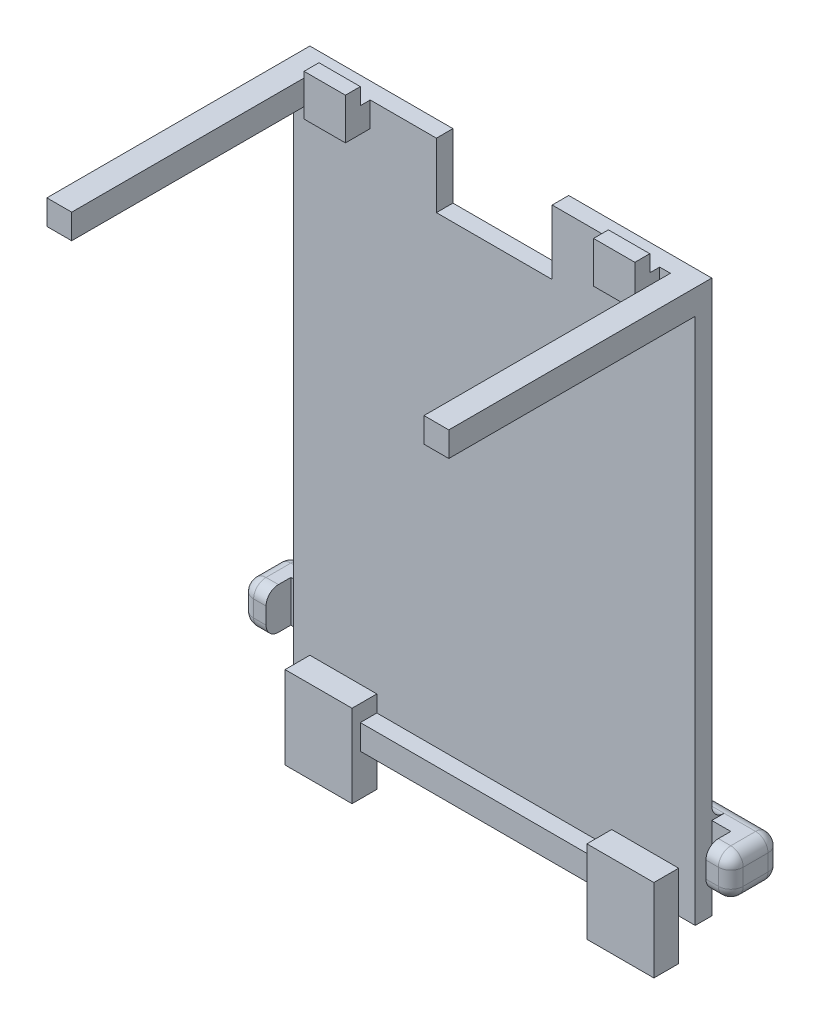
from build123d import *

# Parameters (mm, degrees)
SKETCH_1_W             = 48.6
SKETCH_1_H             = 66.8
EXTRUDE_1_DEPTH        = 2
SKETCH_2_W             = 8.1
SKETCH_2_H             = 10
EXTRUDE_2_DEPTH        = 3
SKETCH_3_W             = 28.4
SKETCH_3_H             = 3
EXTRUDE_3_DEPTH        = 2
SKETCH_4_W             = 14
SKETCH_4_H             = 8
CUT_EXTRUDE_1_DEPTH    = 88.976587795
SKETCH_5_W             = 5
SKETCH_5_H             = 5
EXTRUDE_4_DEPTH        = 3
SKETCH_6_W             = 5
SKETCH_6_H             = 1.2
CUT_EXTRUDE_2_DEPTH    = 2
SKETCH_7_W             = 3
SKETCH_7_H             = 3
EXTRUDE_5_DEPTH        = 29.8
SKETCH_8_W             = 10.3
SKETCH_8_H             = 5
EXTRUDE_6_DEPTH        = 3
SKETCH_9_W             = 3
SKETCH_9_H             = 5
EXTRUDE_7_DEPTH        = 3
FILLET_1_R             = 1.5
FILLET_1_OF_MIRROR_2_R = 1.5


with BuildPart() as part:
    # 草图1 → 凸台-拉伸1 (new body)
    with BuildSketch(Plane(origin=(0, 0, -32), x_dir=(-1, 0, 0), z_dir=(0, 0, -1))):
        with Locations((-14.5, 45.4)):
            Rectangle(SKETCH_1_W, SKETCH_1_H)
    extrude(amount=-EXTRUDE_1_DEPTH)

    # 草图2 → 凸台-拉伸2 (add)
    with BuildSketch(Plane.XY.offset(-30)):
        with Locations((-3.75, 12)):
            Rectangle(SKETCH_2_W, SKETCH_2_H)
    extrude_2 = extrude(amount=EXTRUDE_2_DEPTH)

    # 镜向1: 凸台-拉伸2 across plane
    add(extrude_2.mirror(Plane.ZY.offset(-14.5)))

    # 草图3 → 凸台-拉伸3 (add)
    with BuildSketch(Plane.XY.offset(-30)):
        with Locations((14.5, 13.5)):
            Rectangle(SKETCH_3_W, SKETCH_3_H)
    extrude(amount=EXTRUDE_3_DEPTH)

    # 草图4 → 切除-拉伸1 (cut, through all)
    with BuildSketch(Plane(origin=(0, 0, -32), x_dir=(-1, 0, 0), z_dir=(0, 0, -1))):
        with Locations((-14.5, 75)):
            Rectangle(SKETCH_4_W, SKETCH_4_H)
    extrude(amount=-CUT_EXTRUDE_1_DEPTH, mode=Mode.SUBTRACT)

    # 草图5 → 凸台-拉伸4 (add)
    with BuildSketch(Plane.XY.offset(-30)):
        with Locations((-3, 78.3)):
            Rectangle(SKETCH_5_W, SKETCH_5_H)
        with Locations((32, 78.3)):
            Rectangle(SKETCH_5_W, SKETCH_5_H)
    extrude(amount=EXTRUDE_4_DEPTH)

    # 草图6 → 切除-拉伸2 (cut)
    with BuildSketch(Plane(origin=(0, 80.8, 0), x_dir=(1, 0, 0), z_dir=(0, 1, 0))):
        with Locations((-3, 29.4)):
            Rectangle(SKETCH_6_W, SKETCH_6_H)
        with Locations((32, 29.4)):
            Rectangle(SKETCH_6_W, SKETCH_6_H)
    extrude(amount=-CUT_EXTRUDE_2_DEPTH, mode=Mode.SUBTRACT)

    # 草图7 → 凸台-拉伸5 (add)
    with BuildSketch(Plane.XY.offset(-30)):
        with Locations((-8.3, 77.3)):
            Rectangle(SKETCH_7_W, SKETCH_7_H)
        with Locations((37.3, 77.3)):
            Rectangle(SKETCH_7_W, SKETCH_7_H)
    extrude(amount=EXTRUDE_5_DEPTH)

    # 草图8 → 凸台-拉伸6 (add)
    with BuildSketch(Plane(origin=(0, 0, -32), x_dir=(-1, 0, 0), z_dir=(0, 0, -1))):
        with Locations((9.95, 19.5)):
            Rectangle(SKETCH_8_W, SKETCH_8_H)
    extrude_6 = extrude(amount=EXTRUDE_6_DEPTH)

    # 草图9 → 凸台-拉伸7 (add)
    with BuildSketch(Plane.XY.offset(-32)):
        with Locations((-13.6, 19.5)):
            Rectangle(SKETCH_9_W, SKETCH_9_H)
    extrude_7 = extrude(amount=EXTRUDE_7_DEPTH)

    # 圆角1
    fillet_1_edges = [part.edges().sort_by_distance(p)[0] for p in [
        (-15.1, 19.5, -29),
        (-15.1, 22, -32),
        (-15.1, 17, -32),
        (-4.8, 19.5, -32),
        (-7.3, 17, -32),
        (-9.95, 17, -35),
        (-4.8, 19.5, -35),
        (-7.3, 22, -32),
        (-9.95, 22, -35),
        (-15.1, 19.5, -35),
        (-13.6, 22, -29),
        (-13.6, 17, -29),
    ]]
    fillet(fillet_1_edges, radius=FILLET_1_R - 0.0001)  # a hair under: the kernel refuses the full size

    # 镜向2: 凸台-拉伸6, 凸台-拉伸7 across plane
    add(extrude_6.mirror(Plane.ZY.offset(-14.5)))
    add(extrude_7.mirror(Plane.ZY.offset(-14.5)))

    # 圆角1 of 镜向2
    fillet_1_of_mirror_2_edges = [part.edges().sort_by_distance(p)[0] for p in [
        (44.1, 19.5, -29),
        (44.1, 22, -32),
        (44.1, 17, -32),
        (33.8, 19.5, -32),
        (36.3, 17, -32),
        (38.95, 17, -35),
        (33.8, 19.5, -35),
        (36.3, 22, -32),
        (38.95, 22, -35),
        (44.1, 19.5, -35),
        (42.6, 22, -29),
        (42.6, 17, -29),
    ]]
    fillet(fillet_1_of_mirror_2_edges, radius=FILLET_1_OF_MIRROR_2_R - 0.0001)  # a hair under: the kernel refuses the full size


solid = part.part
